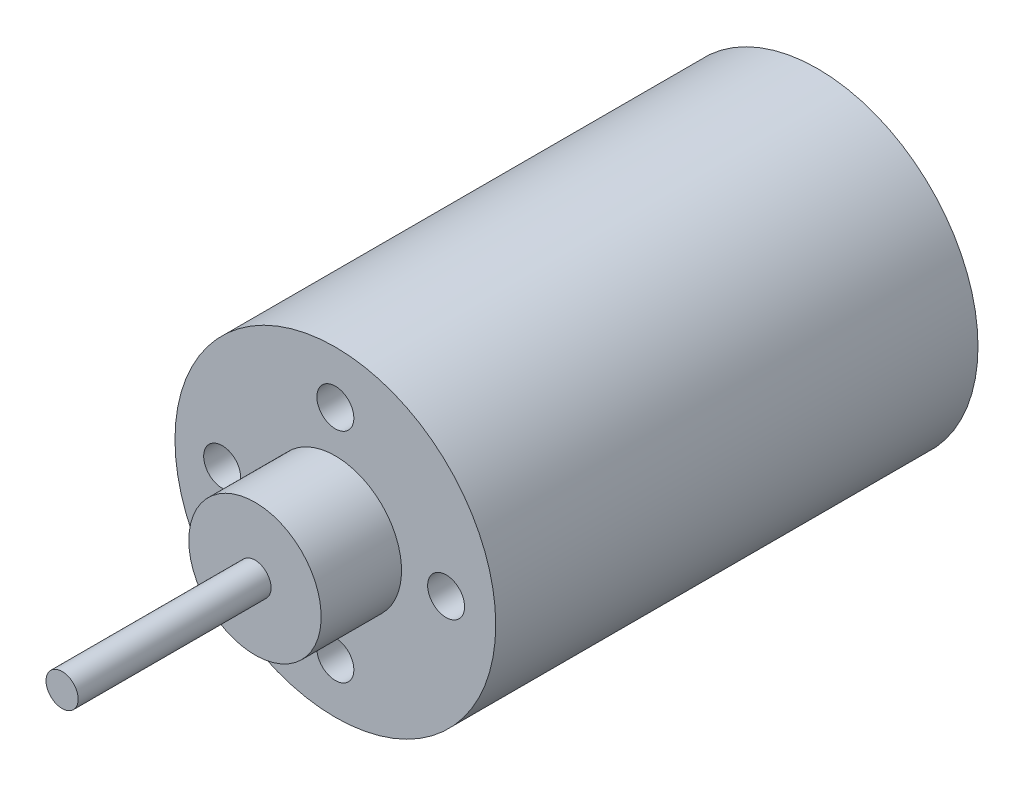
from build123d import *

# Parameters (mm, degrees)
BROCA_DE_ROSQUEAR_PARA_HELICOIDE_M2_21_D     = 2.3
BROCA_DE_ROSQUEAR_PARA_HELICOIDE_M2_21_DEPTH = 3
BROCA_DE_ROSQUEAR_PARA_HELICOIDE_M2_21_TIP   = 0.690989712


with BuildPart() as part:
    # Esboço1 → Revolução1 (revolve)
    with BuildSketch(Plane(origin=(0, 0, 0), x_dir=(0, 0, -1), z_dir=(1, 0, 0))):
        Polygon((-15, 9.97706422), (15, 9.97706422), (15, 0), (-32, 0), (-32, 1), (-20, 1), (-20, 4.116532902), (-15, 4.116532902), align=None)
    revolve(axis=Axis((0, 0, -15), (0, 0, 1)))

    # Broca de rosquear para helicoide M2.21
    with Locations(Plane.XY.offset(15)):
        with Locations((0, 6.719156642), (6.889432955, 0), (0, -6.838865025), (-7.041061835, 0)):
            Hole(BROCA_DE_ROSQUEAR_PARA_HELICOIDE_M2_21_D / 2, depth=BROCA_DE_ROSQUEAR_PARA_HELICOIDE_M2_21_DEPTH)
            with Locations((0, 0, -(BROCA_DE_ROSQUEAR_PARA_HELICOIDE_M2_21_DEPTH + BROCA_DE_ROSQUEAR_PARA_HELICOIDE_M2_21_TIP / 2))):  # 118° drill point
                Cone(0, BROCA_DE_ROSQUEAR_PARA_HELICOIDE_M2_21_D / 2, BROCA_DE_ROSQUEAR_PARA_HELICOIDE_M2_21_TIP, mode=Mode.SUBTRACT)


solid = part.part
